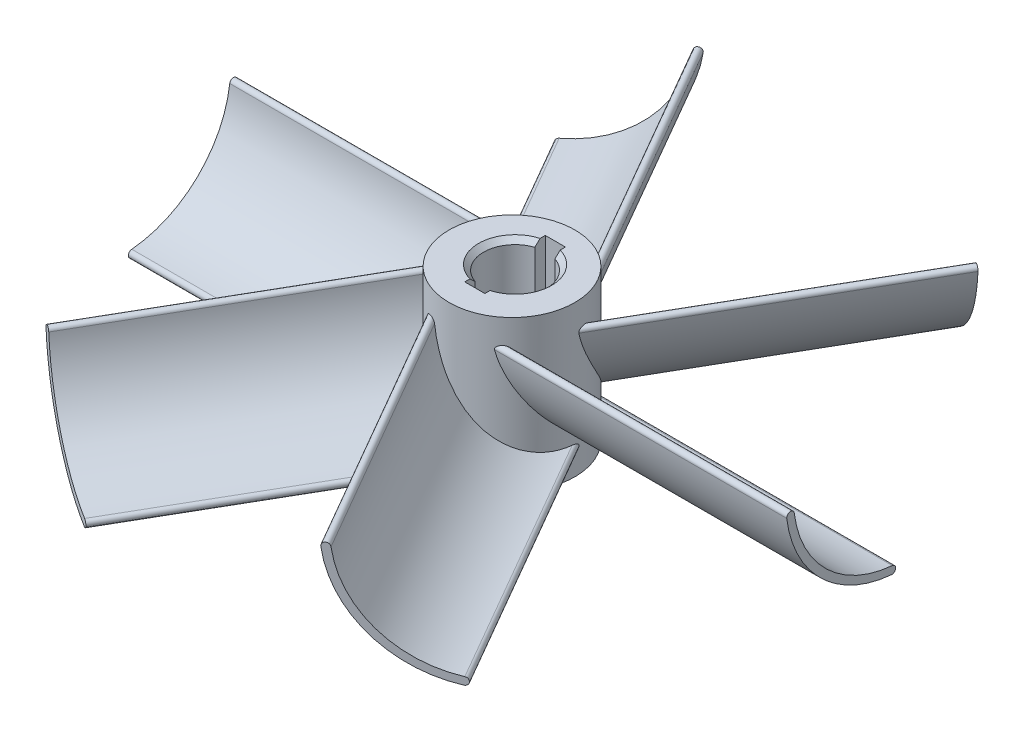
from build123d import *

# Parameters (mm, degrees)
IZIM1_R                     = 25
Y_KSEKLIK_EKSTR_ZYON1_DEPTH = 60
Y_KSEKLIK_EKSTR_ZYON2_DEPTH = 120
DAIRESEL_KAPLAMA1_COUNT     = 6
IZIM6_R                     = 12.5
KES_EKSTR_ZYON2_DEPTH       = 191.090778211
PAH1_SIZE                   = 2
KES_EKSTR_ZYON3_DEPTH       = 191.090778211
KES_EKSTR_ZYON3_DEPTH_BACK  = 191.090778211
IZIM7_W                     = 8
IZIM7_H                     = 32
IZIM8_R                     = 22.5
KES_EKSTR_ZYON4_DEPTH       = 1


with BuildPart() as part:
    # Çizim1 → Yükseklik-Ekstrüzyon1 (new body)
    with BuildSketch(Plane(origin=(0, 0, 0), x_dir=(1, 0, 0), z_dir=(0, 1, 0))):
        with Locations((0, -1.215587275)):
            Circle(IZIM1_R)
    extrude(amount=Y_KSEKLIK_EKSTR_ZYON1_DEPTH)

    # Çizim2 → Yükseklik-Ekstrüzyon2 (add)
    with BuildSketch(Plane(origin=(130, 0, 0), x_dir=(0, 0, -1), z_dir=(1, 0, 0))):
        with BuildLine():
            ThreePointArc((-19.041262861, 48.969586712), (-6.232766913, 23.283881107), (19.892108756, 11.396748898))
            ThreePointArc((19.892108756, 11.396748898), (21.257056095, 9.77288968), (19.633196877, 8.407942341))
            ThreePointArc((19.633196877, 8.407942341), (-8.316033768, 21.125177976), (-22.018973909, 48.604570388))
            ThreePointArc((-22.018973909, 48.604570388), (-20.712626547, 50.275934074), (-19.041262861, 48.969586712))
        make_face()
    y_kseklik_ekstr_zyon2 = extrude(amount=-Y_KSEKLIK_EKSTR_ZYON2_DEPTH)

    # Dairesel Kaplama1: Yükseklik-Ekstrüzyon2 ×6 about axis
    dairesel_kaplama1_axis = Axis((0, 60, 1.215587275), (0, 1, 0))
    for i in range(1, DAIRESEL_KAPLAMA1_COUNT):
        add(y_kseklik_ekstr_zyon2.rotate(dairesel_kaplama1_axis, i * 360 / DAIRESEL_KAPLAMA1_COUNT))

    # Çizim6 → Kes-Ekstrüzyon2 (cut, through all)
    with BuildSketch(Plane(origin=(0, 60, 0), x_dir=(1, 0, 0), z_dir=(0, 1, 0))):
        Circle(IZIM6_R)
    extrude(amount=-KES_EKSTR_ZYON2_DEPTH, mode=Mode.SUBTRACT)

    # Pah1
    pah1_edges = [part.edges().sort_by_distance(p)[0] for p in [
        (-12.5, 0, 0),
        (-12.5, 60, 0),
    ]]
    chamfer(pah1_edges, length=PAH1_SIZE)

    # Çizim7 → Kes-Ekstrüzyon3 (cut, two sides: drawn at the far end of the back side and taken through both)
    with BuildSketch(Plane(origin=(0, 60, 0), x_dir=(1, 0, 0), z_dir=(0, 1, 0)).offset(-KES_EKSTR_ZYON3_DEPTH_BACK)):
        Rectangle(IZIM7_W, IZIM7_H)
    extrude(amount=KES_EKSTR_ZYON3_DEPTH + KES_EKSTR_ZYON3_DEPTH_BACK, mode=Mode.SUBTRACT)

    # Çizim8 → Kes-Ekstrüzyon4 (cut)
    with BuildSketch(Plane.XZ):
        with Locations((0, 1.215587275)):
            Circle(IZIM8_R)
    extrude(amount=-KES_EKSTR_ZYON4_DEPTH, mode=Mode.SUBTRACT)


solid = part.part
